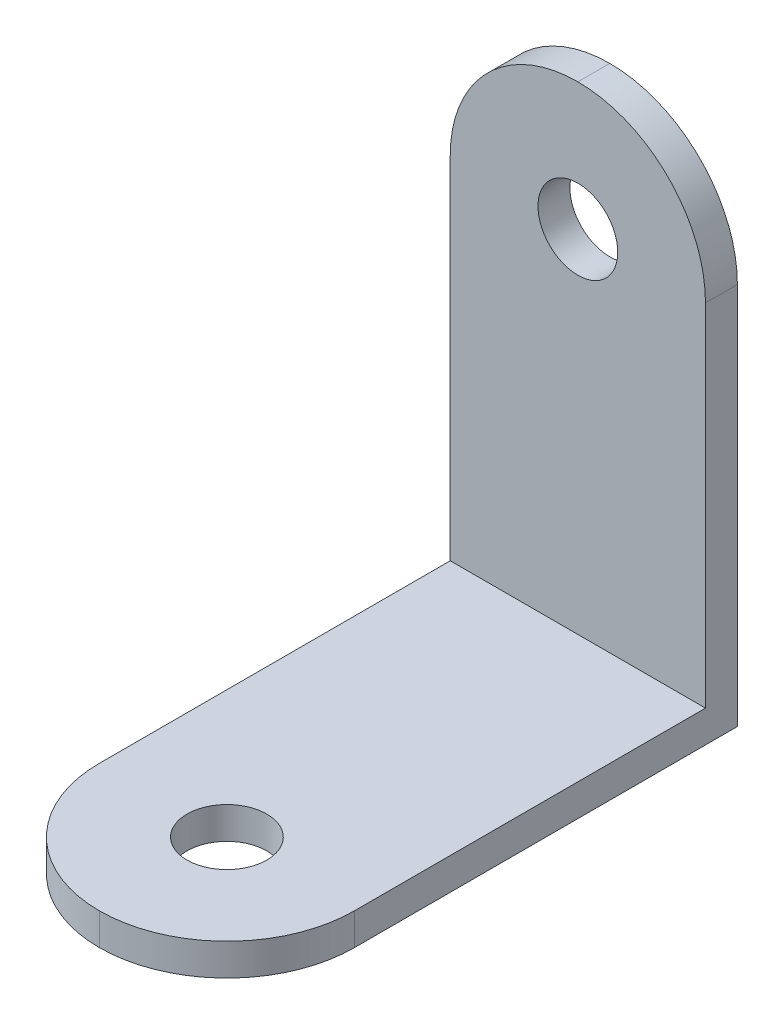
from build123d import *

# Parameters (mm, degrees)
SKETCH_1_W          = 16
SKETCH_1_H          = 2
EXTRUDE_1_DEPTH     = 30
FILLET_1_R          = 8
FILLET_2_R          = 8
SKETCH_2_W          = 16
SKETCH_2_H          = 2
EXTRUDE_2_DEPTH     = 32
FILLET_3_R          = 8
FILLET_4_R          = 8
SKETCH_4_R          = 2.5
CUT_EXTRUDE_2_DEPTH = 2
SKETCH_3_R          = 2.5
CUT_EXTRUDE_3_DEPTH = 2


with BuildPart() as part:
    # 草图1 → 凸台-拉伸1 (new body)
    with BuildSketch(Plane.XY):
        with Locations((8, 1)):
            Rectangle(SKETCH_1_W, SKETCH_1_H)
    extrude(amount=EXTRUDE_1_DEPTH)

    # 圆角1
    fillet_1_edges = [part.edges().sort_by_distance(p)[0] for p in [
        (0, 1, 30),
    ]]
    fillet(fillet_1_edges, radius=FILLET_1_R)

    # 圆角2
    fillet_2_edges = [part.edges().sort_by_distance(p)[0] for p in [
        (16, 1, 30),
    ]]
    fillet(fillet_2_edges, radius=FILLET_2_R - 0.0001)  # a hair under: the kernel refuses the full size

    # 草图2 → 凸台-拉伸2 (add)
    with BuildSketch(Plane(origin=(0, 0, 0), x_dir=(1, 0, 0), z_dir=(0, 1, 0))):
        with Locations((8, 1)):
            Rectangle(SKETCH_2_W, SKETCH_2_H)
    extrude(amount=EXTRUDE_2_DEPTH)

    # 圆角3
    fillet_3_edges = [part.edges().sort_by_distance(p)[0] for p in [
        (16, 32, -1),
    ]]
    fillet(fillet_3_edges, radius=FILLET_3_R)

    # 圆角4
    fillet_4_edges = [part.edges().sort_by_distance(p)[0] for p in [
        (0, 32, -1),
    ]]
    fillet(fillet_4_edges, radius=FILLET_4_R - 0.0001)  # a hair under: the kernel refuses the full size

    # 草图4 → 切除-拉伸2 (cut)
    with BuildSketch(Plane(origin=(0, 2, 0), x_dir=(1, 0, 0), z_dir=(0, 1, 0))):
        with Locations(Location((8, -22, 0), (0, 0, 270))):
            Circle(SKETCH_4_R)
    extrude(amount=-CUT_EXTRUDE_2_DEPTH, mode=Mode.SUBTRACT)

    # 草图3 → 切除-拉伸3 (cut)
    with BuildSketch(Plane.XY):
        with Locations((8, 24)):
            Circle(SKETCH_3_R)
        with Locations((8, 40)):
            Circle(SKETCH_3_R)
    extrude(amount=-CUT_EXTRUDE_3_DEPTH, mode=Mode.SUBTRACT)


solid = part.part
